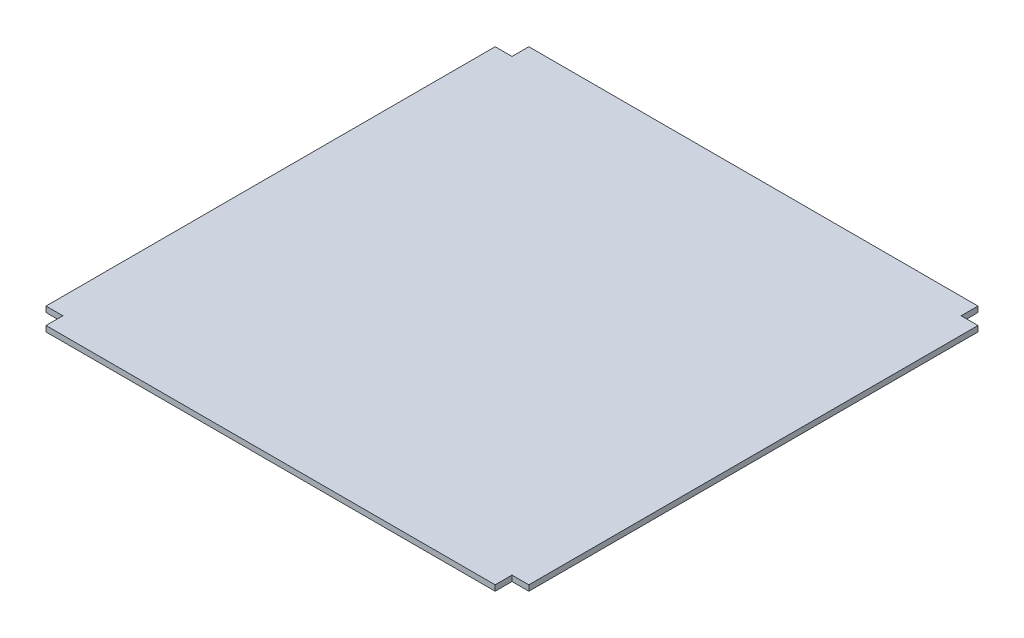
from build123d import *

# Parameters (mm, degrees)
BOSS_EXTRUDE1_DEPTH = 10


with BuildPart() as part:
    # Sketch1 → Boss-Extrude1 (new body)
    with BuildSketch(Plane(origin=(0, 0, 0), x_dir=(1, 0, 0), z_dir=(0, 1, 0))):
        Polygon((400, 430), (-400, 430), (-400, 400), (-430, 400), (-430, -400), (-400, -400), (-400, -430), (400, -430), (400, -400), (430, -400), (430, 400), (400, 400), align=None)
    extrude(amount=BOSS_EXTRUDE1_DEPTH)


solid = part.part
